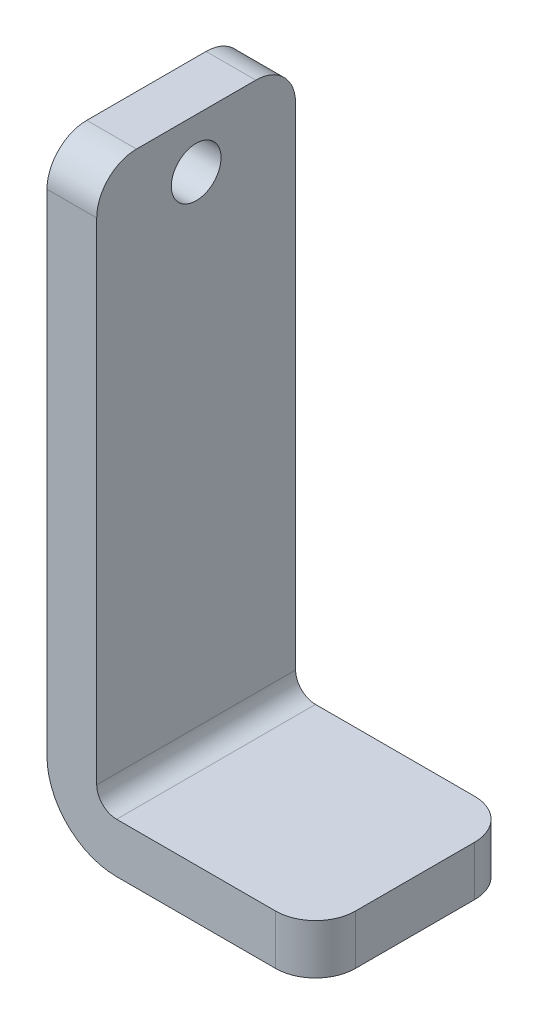
from build123d import *

# Parameters (mm, degrees)
BOSS_EXTRUDE1_DEPTH = 12.7
FILLET1_R           = 2.54
CUT_EXTRUDE2_REACH  = 33.005


with BuildPart() as part:
    # Sketch1 → Boss-Extrude1 (new body)
    with BuildSketch(Plane.XY):
        with BuildLine():
            Line((0, 22.49580667), (0, -11.38626933))
            ThreePointArc((0, -11.38626933), (0.371974388, -12.284294942), (1.27, -12.65626933))
            Line((1.27, -12.65626933), (13.97, -12.65626933))
            Line((13.97, -12.65626933), (13.97, -15.83126933))
            Line((13.97, -15.83126933), (1.27, -15.83126933))
            ThreePointArc((1.27, -15.83126933), (-1.873089642, -14.529358972), (-3.175, -11.38626933))
            Line((-3.175, -11.38626933), (-3.175, 22.49580667))
            Line((-3.175, 22.49580667), (0, 22.49580667))
        make_face()
    extrude(amount=BOSS_EXTRUDE1_DEPTH)

    # Fillet1
    fillet1_edges = [part.edges().sort_by_distance(p)[0] for p in [
        (13.97, -14.24376933, 0),
        (13.97, -14.24376933, 12.7),
        (-1.5875, 22.49580667, 0),
        (-1.5875, 22.49580667, 12.7),
    ]]
    fillet(fillet1_edges, radius=FILLET1_R)

    # Sketch5 → Cut-Extrude2 (cut, up to next)
    with BuildSketch(Plane.ZY.offset(3.175), mode=Mode.PRIVATE) as cut_extrude2_sk1:
        with BuildLine():
            ThreePointArc((7.9375, 19.32080667), (7.472532015, 20.443338685), (6.35, 20.90830667))
            ThreePointArc((6.35, 20.90830667), (5.227467985, 18.198274655), (7.9375, 19.32080667))
        make_face()
    cut_extrude2_tool1 = extrude(cut_extrude2_sk1.sketch, amount=-CUT_EXTRUDE2_REACH, mode=Mode.PRIVATE) & part.part
    add(cut_extrude2_tool1.solids().sort_by_distance((-3.175, 19.320807, 6.35))[0], mode=Mode.SUBTRACT)


solid = part.part
